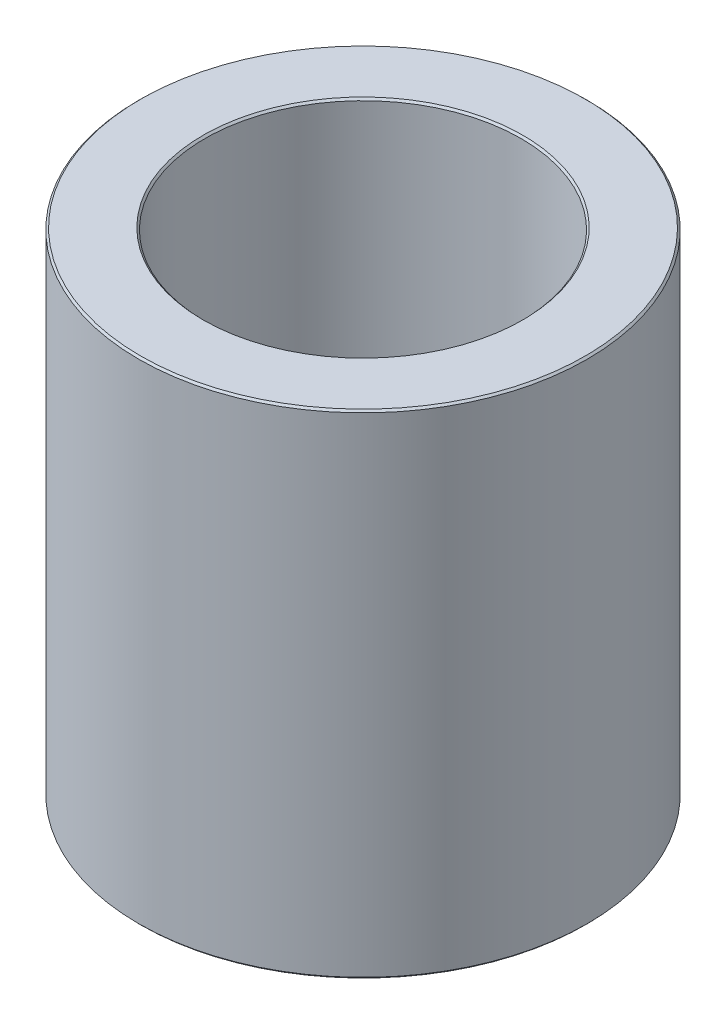
from build123d import *
from OCP.BRepFilletAPI import BRepFilletAPI_MakeChamfer

# Parameters (mm, degrees)
SKETCH1_R           = 52.5
BOSS_EXTRUDE1_DEPTH = 115.308149564
SKETCH2_R           = 37.006136166
CUT_EXTRUDE1_DEPTH  = 138.143973094
CHAMFER1_SIZE       = 0.430139215
CHAMFER1_SIZE2      = 0.448155147


with BuildPart() as part:
    # Sketch1 → Boss-Extrude1 (new body)
    with BuildSketch(Plane(origin=(0, 0, 0), x_dir=(1, 0, 0), z_dir=(0, 1, 0))):
        Circle(SKETCH1_R)
    extrude(amount=BOSS_EXTRUDE1_DEPTH)

    # Sketch2 → Cut-Extrude1 (cut, through all)
    with BuildSketch(Plane(origin=(0, 0, 0), x_dir=(1, 0, 0), z_dir=(0, 1, 0))):
        Circle(SKETCH2_R)
    extrude(amount=CUT_EXTRUDE1_DEPTH, mode=Mode.SUBTRACT)

    # Chamfer1: one chamfer whose edges measure the first distance from different faces: ONE call of the kernel's chamfer builder (chamfer() names one face for all edges)
    chamfer1_edges_1 = [part.edges().sort_by_distance(p)[0] for p in [
        (-37.006136166, 115.308149564, 0),
    ]]
    chamfer1_side_1 = [part.faces().sort_by_distance(p)[0] for p in [
        (-51.01507576, 115.308149564, 0),
    ]]
    chamfer1_edges_2 = [part.edges().sort_by_distance(p)[0] for p in [
        (-37.006136166, 0, 0),
    ]]
    chamfer1_side_2 = [part.faces().sort_by_distance(p)[0] for p in [
        (-37.006136166, 57.654074782, 0),
    ]]
    chamfer1_edges_3 = [part.edges().sort_by_distance(p)[0] for p in [
        (-52.5, 0, 0),
    ]]
    chamfer1_side_3 = [part.faces().sort_by_distance(p)[0] for p in [
        (-51.01507576, 0, 0),
    ]]
    chamfer1_edges_4 = [part.edges().sort_by_distance(p)[0] for p in [
        (-52.5, 115.308149564, 0),
    ]]
    chamfer1_side_4 = [part.faces().sort_by_distance(p)[0] for p in [
        (-52.5, 57.654074782, 0),
    ]]
    chamfer1 = BRepFilletAPI_MakeChamfer(part.part.solid().wrapped)
    for e in chamfer1_edges_1:
        chamfer1.Add(CHAMFER1_SIZE, CHAMFER1_SIZE2, e.wrapped, chamfer1_side_1[0].wrapped)  # the first distance lies on this face
    for e in chamfer1_edges_2:
        chamfer1.Add(CHAMFER1_SIZE, CHAMFER1_SIZE2, e.wrapped, chamfer1_side_2[0].wrapped)  # the first distance lies on this face
    for e in chamfer1_edges_3:
        chamfer1.Add(CHAMFER1_SIZE, CHAMFER1_SIZE2, e.wrapped, chamfer1_side_3[0].wrapped)  # the first distance lies on this face
    for e in chamfer1_edges_4:
        chamfer1.Add(CHAMFER1_SIZE, CHAMFER1_SIZE2, e.wrapped, chamfer1_side_4[0].wrapped)  # the first distance lies on this face
    add(Compound.cast(chamfer1.Shape()), mode=Mode.REPLACE)


solid = part.part
